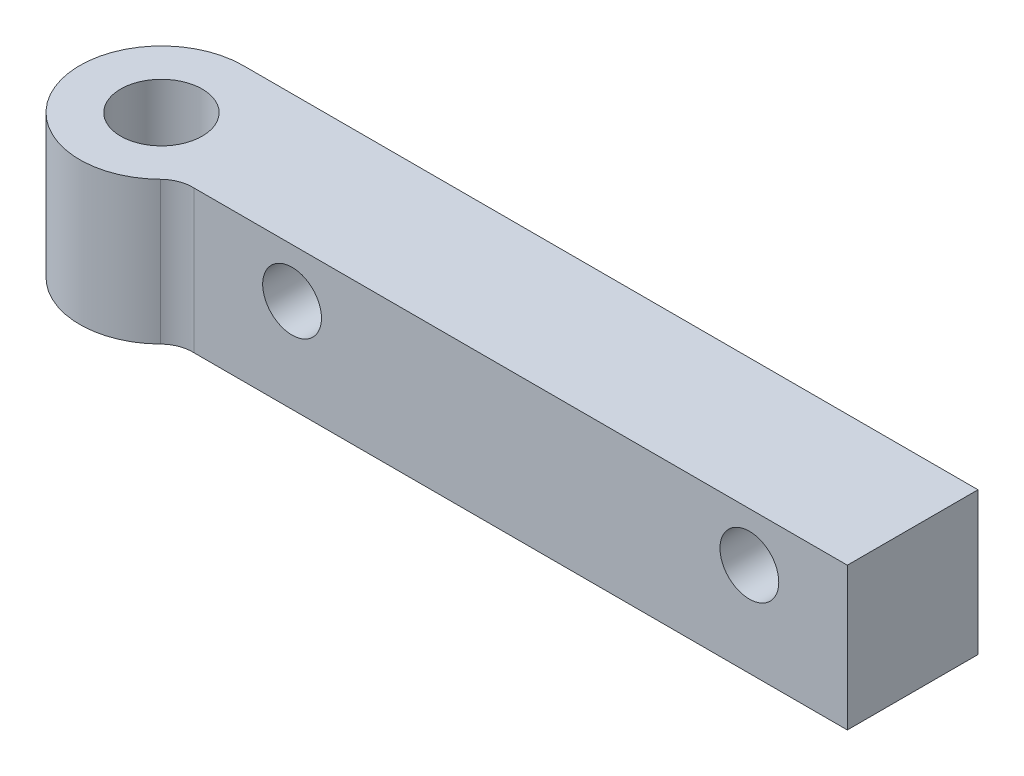
from build123d import *

# Parameters (mm, degrees)
SKETCH1_R           = 3.175
BOSS_EXTRUDE1_DEPTH = 5.5499
FILLET1_START       = -5.5499
FILLET1_DEPTH       = 11.0998
SKETCH2_R           = 2.286
SKETCH2_R_2         = 1.89865
CUT_EXTRUDE1_DEPTH  = 5.08


with BuildPart() as part:
    # Sketch1 → Boss-Extrude1 (new, symmetric)
    with BuildSketch(Plane(origin=(0, 0, 0), x_dir=(1, 0, 0), z_dir=(0, 1, 0))):
        with BuildLine():
            Line((0, 6.35), (12.366459894, 6.35))
            Line((12.366459894, 6.35), (57.15, 6.35))
            Line((57.15, 6.35), (57.15, -3.81))
            Line((57.15, -3.81), (6.35, -3.81))
            Line((6.35, -3.81), (6.35, 0))
            ThreePointArc((6.35, 0), (-4.490128061, -4.490128061), (0, 6.35))
        make_face()
        with Locations(Location((0, 0, 0), (0, 0, 270))):
            Circle(SKETCH1_R, mode=Mode.SUBTRACT)
    extrude(amount=BOSS_EXTRUDE1_DEPTH, both=True)

    # Fillet1: read off the stored shape, not the designer's step
    # Fillet1 outline → Fillet1 (add)
    with BuildSketch(Plane(origin=(0, 0, 0), x_dir=(1, 0, 0), z_dir=(0, 1, 0)).offset(FILLET1_START)):
        with BuildLine():
            ThreePointArc((4.446322142, -4.533510716), (5.322474594, -3.972611562), (6.35, -3.81))
            Line((6.35, -3.81), (6.35, 0))
            ThreePointArc((6.35, 0), (5.854769236, -2.458490838), (4.446322142, -4.533510716))
        make_face()
    extrude(amount=FILLET1_DEPTH)

    # Sketch2 → Cut-Extrude1 (cut)
    with BuildSketch(Plane.XY.offset(3.81)):
        with Locations((13.97, 1.7399)):
            Circle(SKETCH2_R)
        with Locations((49.53, 1.7399)):
            Circle(SKETCH2_R)
        with Locations((13.97, 1.7399)):
            Circle(SKETCH2_R_2)
        with Locations((49.53, 1.7399)):
            Circle(SKETCH2_R_2)
    extrude(amount=-CUT_EXTRUDE1_DEPTH, mode=Mode.SUBTRACT)


solid = part.part
